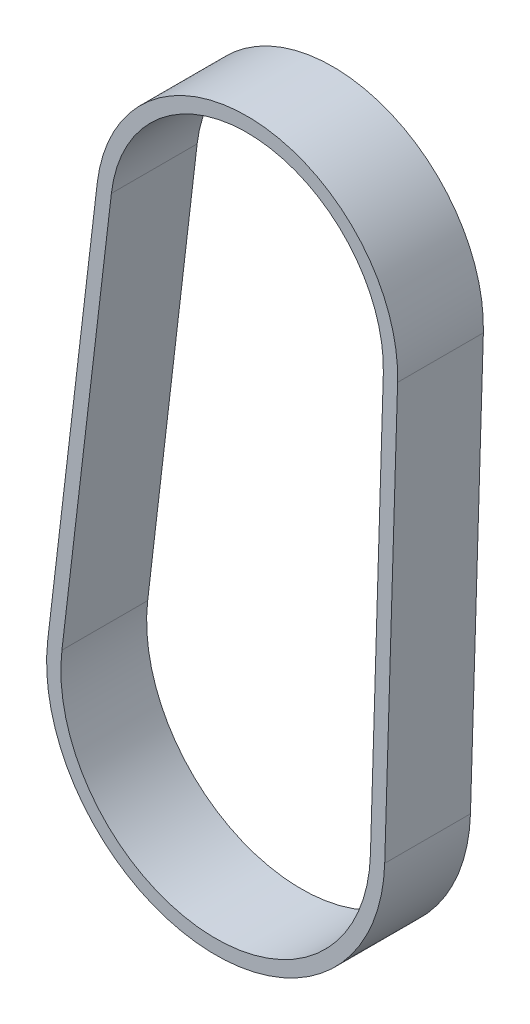
from build123d import *

# Parameters (mm, degrees)
EXTRUDE_THIN1_DEPTH = 9


with BuildPart() as part:
    # Sketch2 → Extrude-Thin1 (new body)
    with BuildSketch(Plane.XY):
        with BuildLine():
            Line((15.816597751, -0.482148399), (14.46320707, -44.879342416))
            ThreePointArc((14.46320707, -44.879342416), (-4.587477971, -62.040180558), (-20.906900785, -42.263947213))
            Line((-20.906900785, -42.263947213), (-15.715494476, 1.849449885))
            ThreePointArc((-15.715494476, 1.849449885), (1.166894643, 15.780861459), (15.816597751, -0.482148399))
        make_face()
        with BuildLine():
            Line((14.317294208, -0.436444081), (12.963903527, -44.833638098))
            ThreePointArc((12.963903527, -44.833638098), (-4.476864469, -60.544264567), (-19.417181129, -42.439262208))
            Line((-19.417181129, -42.439262208), (-14.225774821, 1.674134889))
            ThreePointArc((-14.225774821, 1.674134889), (1.05628114, 14.284945468), (14.317294208, -0.436444081))
        make_face(mode=Mode.SUBTRACT)
    extrude(amount=EXTRUDE_THIN1_DEPTH)


solid = part.part
